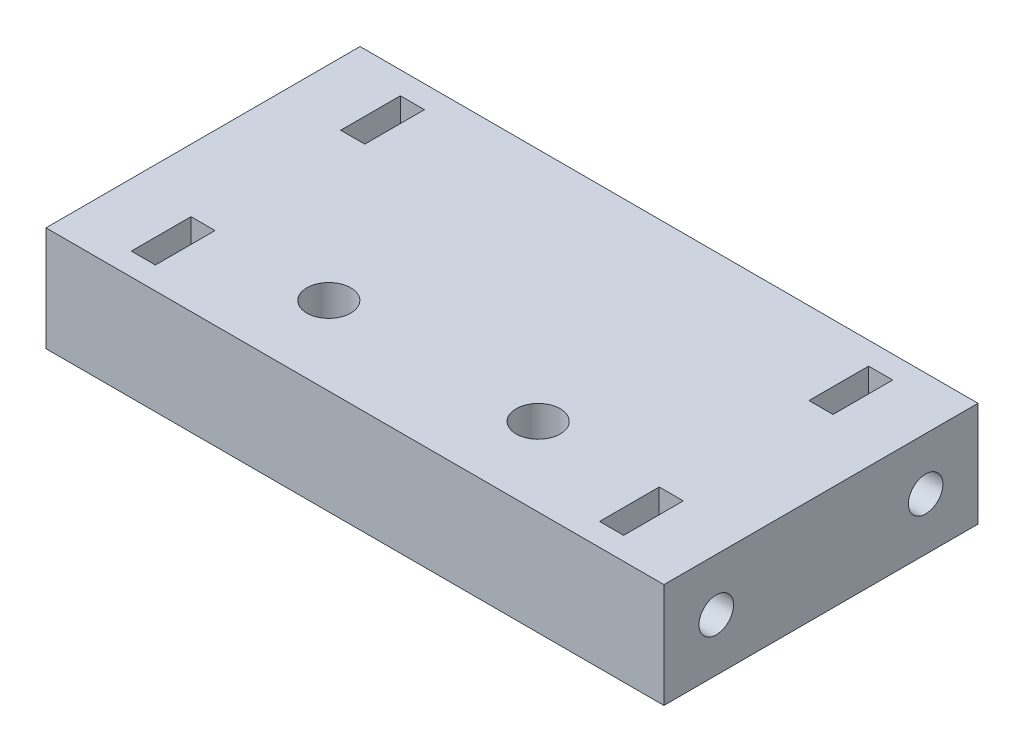
from build123d import *

# Parameters (mm, degrees)
SKETCH1_W           = 59.0272
SKETCH1_H           = 30
BOSS_EXTRUDE1_DEPTH = 10
SKETCH2_R           = 2.1
CUT_EXTRUDE1_DEPTH  = 35.58399319
SKETCH3_R           = 1.65
CUT_EXTRUDE2_DEPTH  = 12
CUT_EXTRUDE3_START  = -12
SKETCH4_R           = 1.65
CUT_EXTRUDE3_DEPTH  = 12
CUT_EXTRUDE4_DEPTH  = 2.3
CUT_EXTRUDE5_DEPTH  = 2.3


with BuildPart() as part:
    # Sketch1 → Boss-Extrude1 (new body)
    with BuildSketch(Plane(origin=(0, 0, 0), x_dir=(1, 0, 0), z_dir=(0, 1, 0))):
        Rectangle(SKETCH1_W, SKETCH1_H)
    extrude(amount=BOSS_EXTRUDE1_DEPTH)

    # Sketch2 → Cut-Extrude1 (cut, through all)
    with BuildSketch(Plane(origin=(0, 10, 0), x_dir=(1, 0, 0), z_dir=(0, 1, 0))):
        with Locations((-10, -7.5)):
            Circle(SKETCH2_R)
        with Locations((10, -7.5)):
            Circle(SKETCH2_R)
    extrude(amount=-CUT_EXTRUDE1_DEPTH, mode=Mode.SUBTRACT)

    # Sketch3 → Cut-Extrude2 (cut)
    with BuildSketch(Plane(origin=(29.5136, 0, 0), x_dir=(0, 0, -1), z_dir=(1, 0, 0))):
        with Locations((-10, 5)):
            Circle(SKETCH3_R)
        with Locations((10, 5)):
            Circle(SKETCH3_R)
    extrude(amount=-CUT_EXTRUDE2_DEPTH, mode=Mode.SUBTRACT)

    # Sketch4 → Cut-Extrude3 (cut)
    with BuildSketch(Plane.ZY.offset(29.5136).offset(CUT_EXTRUDE3_START)):
        with Locations((-10, 5)):
            Circle(SKETCH4_R)
        with Locations((10, 5)):
            Circle(SKETCH4_R)
    extrude(amount=CUT_EXTRUDE3_DEPTH, mode=Mode.SUBTRACT)

    # Sketch5 → Cut-Extrude4 (cut)
    with BuildSketch(Plane(origin=(23.5136, 0, 0), x_dir=(0, 0, -1), z_dir=(1, 0, 0))):
        Polygon((-12.85, 6.645448267), (-12.85, 10), (-7.15, 10), (-7.15, 6.645448267), (-7.15, 3.354551733), (-10, 1.709103466), (-12.85, 3.354551733), align=None)
        Polygon((7.15, 6.645448267), (7.15, 3.354551733), (10, 1.709103466), (12.85, 3.354551733), (12.85, 6.645448267), (12.85, 10), (7.15, 10), align=None)
    extrude(amount=-CUT_EXTRUDE4_DEPTH, mode=Mode.SUBTRACT)

    # Sketch6 → Cut-Extrude5 (cut)
    with BuildSketch(Plane.ZY.offset(23.5136)):
        Polygon((-12.85, 6.645448267), (-12.85, 10), (-7.15, 10), (-7.15, 6.645448267), (-7.15, 3.354551733), (-10, 1.709103466), (-12.85, 3.354551733), align=None)
        Polygon((7.15, 6.645448267), (7.15, 3.354551733), (10, 1.709103466), (12.85, 3.354551733), (12.85, 6.645448267), (12.85, 10), (7.15, 10), align=None)
    extrude(amount=-CUT_EXTRUDE5_DEPTH, mode=Mode.SUBTRACT)


solid = part.part
